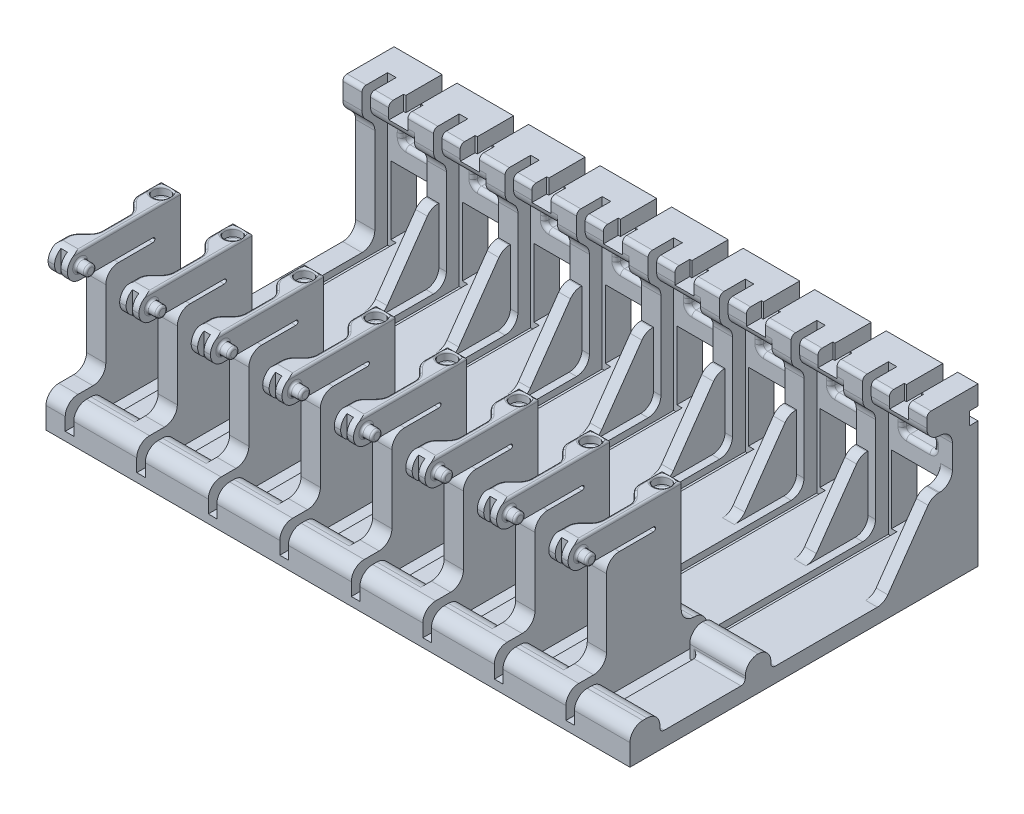
from build123d import *

# Parameters (mm, degrees)
SKETCH1_W            = 19.5
SKETCH1_H            = 81.5
BOSS_EXTRUDE1_DEPTH  = 2.5
SKETCH2_W            = 19.5
SKETCH2_H            = 6
BOSS_EXTRUDE2_DEPTH  = 33.5
SKETCH3_W            = 11.5
SKETCH3_H            = 16
CUT_EXTRUDE1_DEPTH   = 38
SKETCH4_W            = 2
SKETCH4_H            = 75.5
CUT_EXTRUDE2_DEPTH   = 1.5
BOSS_EXTRUDE10_DEPTH = 4.5
BOSS_EXTRUDE12_START = 2
SKETCH17_W           = 6
SKETCH17_H           = 4.5
SKETCH17_W_2         = 7
SKETCH17_H_2         = 6
BOSS_EXTRUDE12_DEPTH = 4
SKETCH22_W           = 4
SKETCH22_H           = 20
CUT_EXTRUDE6_DEPTH   = 1.5
SKETCH15_W           = 15.5
SKETCH15_H           = 6
CUT_EXTRUDE4_DEPTH   = 3
CHAMFER3_SIZE        = 3.5
SKETCH18_R           = 1.25
BOSS_EXTRUDE13_DEPTH = 2.5
FILLET11_R           = 0.5
CUT_EXTRUDE5_REACH   = 93.206
SKETCH20_W           = 1.5
SKETCH20_H           = 3
SKETCH21_W           = 2.75
SKETCH21_H           = 16
BOSS_EXTRUDE15_DEPTH = 2.5
CHAMFER4_SIZE        = 19.279998091
CHAMFER4_SIZE_2      = 13.5
SKETCH24_W           = 6
SKETCH24_H           = 6
SKETCH24_H_2         = 4.5
SKETCH24_W_2         = 7
BOSS_EXTRUDE17_DEPTH = 9
SKETCH29_W           = 7.5
SKETCH29_H           = 3
CUT_EXTRUDE9_DEPTH   = 86.88655308
SKETCH31_W           = 19.5
SKETCH31_H           = 81.5
BOSS_EXTRUDE20_DEPTH = 1
SKETCH32_R           = 1
CUT_EXTRUDE10_DEPTH  = 33.5
SKETCH33_R           = 1.875
CUT_EXTRUDE11_DEPTH  = 2
CUT_EXTRUDE12_DEPTH  = 3.5
FILLET10_R           = 3
FILLET15_R           = 1
FILLET16_R           = 0.5
CUT_EXTRUDE14_DEPTH  = 2
LPATTERN6_COUNT      = 8
LPATTERN6_PITCH      = 16.75


with BuildPart() as part:
    # Sketch1 → Boss-Extrude1 (new body)
    with BuildSketch(Plane(origin=(0, 0, 0), x_dir=(1, 0, 0), z_dir=(0, 1, 0))):
        with Locations((9.75, 40.75)):
            Rectangle(SKETCH1_W, SKETCH1_H)
    extrude(amount=BOSS_EXTRUDE1_DEPTH)

    # Sketch2 → Boss-Extrude2 (add)
    with BuildSketch(Plane(origin=(0, 2.5, 0), x_dir=(1, 0, 0), z_dir=(0, 1, 0))):
        with Locations((9.75, 78.5)):
            Rectangle(SKETCH2_W, SKETCH2_H)
    extrude(amount=BOSS_EXTRUDE2_DEPTH)

    # Sketch3 → Cut-Extrude1 (cut)
    with BuildSketch(Plane.XY.offset(-75.5)):
        with Locations((11, 10.5)):
            Rectangle(SKETCH3_W, SKETCH3_H)
    extrude(amount=-CUT_EXTRUDE1_DEPTH, mode=Mode.SUBTRACT)

    # Sketch4 → Cut-Extrude2 (cut)
    with BuildSketch(Plane(origin=(0, 2.5, 0), x_dir=(1, 0, 0), z_dir=(0, 1, 0))):
        with Locations((5.5, 37.75)):
            Rectangle(SKETCH4_W, SKETCH4_H)
    extrude(amount=-CUT_EXTRUDE2_DEPTH, mode=Mode.SUBTRACT)

    # Sketch14 → Boss-Extrude10 (add)
    with BuildSketch(Plane.ZY):
        Polygon((-75.5, 36), (-69.5, 36), (-69.5, 30), (-72.5, 27), (-72.5, 2.5), (-75.5, 2.5), align=None)
        Polygon((-33, 2.5), (-33, 7), (-27, 7), (-27, 15.5), (-27, 21.5), (-27, 36), (-0.5, 36), (-0.5, 30), (-21, 30), (-21, 29), (-9.5, 29), (-9.5, 7), (0, 7), (0, 2.5), align=None)
    extrude(amount=-BOSS_EXTRUDE10_DEPTH)

    # Sketch17 → Boss-Extrude12 (add)
    with BuildSketch(Plane(origin=(4.5, 0, 0), x_dir=(0, 0, -1), z_dir=(1, 0, 0)).offset(BOSS_EXTRUDE12_START)):
        with Locations((30, 4.75)):
            Rectangle(SKETCH17_W, SKETCH17_H)
        with Locations((3.5, 4.75)):
            Rectangle(SKETCH17_W_2, SKETCH17_H)
        with Locations((72.5, 33)):
            Rectangle(SKETCH17_W, SKETCH17_H_2)
    extrude(amount=BOSS_EXTRUDE12_DEPTH)

    # Sketch22 → Cut-Extrude6 (cut)
    with BuildSketch(Plane(origin=(0, 2.5, 0), x_dir=(1, 0, 0), z_dir=(0, 1, 0))):
        with Locations((6.5, 17)):
            Rectangle(SKETCH22_W, SKETCH22_H)
    extrude(amount=-CUT_EXTRUDE6_DEPTH, mode=Mode.SUBTRACT)

    # Sketch15 → Cut-Extrude4 (cut)
    with BuildSketch(Plane.ZY):
        with Locations((-13.25, 33)):
            Rectangle(SKETCH15_W, SKETCH15_H)
    extrude(amount=-CUT_EXTRUDE4_DEPTH, mode=Mode.SUBTRACT)

    # Chamfer3
    # the kernel refuses this chamfer: 3.5 mm, written as the material it adds along each edge
    with BuildSketch(Plane(origin=(3, 36, -21), x_dir=(0, 0, 1), z_dir=(0, -1, 0))) as chamfer3_piece_1_section:
        Polygon((CHAMFER3_SIZE, 0), (0, CHAMFER3_SIZE), (0, 0), align=None)
    chamfer3_piece_1 = extrude(amount=6, mode=Mode.PRIVATE)
    chamfer3_piece_1 = split(chamfer3_piece_1, bisect_by=Plane(origin=(0, 36, -21), z_dir=(1, 0, 0)), keep=Keep.TOP, mode=Mode.PRIVATE)
    add(chamfer3_piece_1)
    with BuildSketch(Plane(origin=(3, 30, -5.5), x_dir=(-1, 0, 0), z_dir=(0, 1, 0))) as chamfer3_piece_2_section:
        Polygon((CHAMFER3_SIZE, 0), (0, -CHAMFER3_SIZE), (0, 0), align=None)
    chamfer3_piece_2 = extrude(amount=6, mode=Mode.PRIVATE)
    chamfer3_piece_2 = split(chamfer3_piece_2, bisect_by=Plane(origin=(0, 30, -5.5), z_dir=(1, 0, 0)), keep=Keep.TOP, mode=Mode.PRIVATE)
    add(chamfer3_piece_2)

    # Sketch18 → Boss-Extrude13 (add)
    with BuildSketch(Plane(origin=(4.5, 0, 0), x_dir=(0, 0, -1), z_dir=(1, 0, 0))):
        with Locations(Location((3.5, 33, 0), (0, 0, 180))):
            Circle(SKETCH18_R)
    extrude(amount=BOSS_EXTRUDE13_DEPTH)

    # Fillet11
    fillet11_edges = [part.edges().sort_by_distance(p)[0] for p in [
        (4.5, 33, -4.75),
        (7, 33, -4.75),
    ]]
    fillet(fillet11_edges, radius=FILLET11_R)

    # Sketch20 → Cut-Extrude5 (cut, up to next)
    with BuildSketch(Plane(origin=(0, 36, 0), x_dir=(1, 0, 0), z_dir=(0, 1, 0)), mode=Mode.PRIVATE) as cut_extrude5_sk1:
        with Locations((2.25, 0.5)):
            Rectangle(SKETCH20_W, SKETCH20_H)
    cut_extrude5_tool1 = extrude(cut_extrude5_sk1.sketch, amount=-CUT_EXTRUDE5_REACH, mode=Mode.PRIVATE) & part.part
    add(cut_extrude5_tool1.solids().sort_by_distance((2.25, 36, -0.5))[0], mode=Mode.SUBTRACT)

    # Sketch21 → Boss-Extrude15 (add)
    with BuildSketch(Plane.XY.offset(-75.5)):
        with Locations((18.125, 10.5)):
            Rectangle(SKETCH21_W, SKETCH21_H)
    extrude(amount=BOSS_EXTRUDE15_DEPTH)

    # Chamfer4
    # the kernel refuses this chamfer: 19.279998091, 13.5 mm, written as the material it adds along each edge
    with BuildSketch(Plane(origin=(19.5, 2.5, -73), x_dir=(0, 1, 0), z_dir=(-1, 0, 0))) as chamfer4_piece_1_section:
        Polygon((CHAMFER4_SIZE, 0), (0, -CHAMFER4_SIZE_2), (0, 0), align=None)
    chamfer4_piece_1 = extrude(amount=2.75, mode=Mode.PRIVATE)
    chamfer4_piece_1 = split(chamfer4_piece_1, bisect_by=Plane(origin=(19.5, 18.5, -73), z_dir=(0, -1, 0)), keep=Keep.TOP, mode=Mode.PRIVATE)
    add(chamfer4_piece_1)

    # Sketch24 → Boss-Extrude17 (add)
    with BuildSketch(Plane(origin=(10.5, 0, 0), x_dir=(0, 0, -1), z_dir=(1, 0, 0))):
        with Locations((72.5, 33)):
            Rectangle(SKETCH24_W, SKETCH24_H)
        with Locations((30, 4.75)):
            Rectangle(SKETCH24_W, SKETCH24_H_2)
        with Locations((3.5, 4.75)):
            Rectangle(SKETCH24_W_2, SKETCH24_H_2)
    extrude(amount=BOSS_EXTRUDE17_DEPTH)

    # Sketch29 → Cut-Extrude9 (cut, through all)
    with BuildSketch(Plane.XY.offset(-75.5)):
        with Locations((11.5, 24.5)):
            Rectangle(SKETCH29_W, SKETCH29_H)
    extrude(amount=-CUT_EXTRUDE9_DEPTH, mode=Mode.SUBTRACT)

    # Sketch31 → Boss-Extrude20 (add)
    with BuildSketch(Plane.XZ):
        with Locations((9.75, -40.75)):
            Rectangle(SKETCH31_W, SKETCH31_H)
    extrude(amount=BOSS_EXTRUDE20_DEPTH)

    # Sketch32 → Cut-Extrude10 (cut)
    with BuildSketch(Plane(origin=(0, 36, 0), x_dir=(1, 0, 0), z_dir=(0, 1, 0))):
        with Locations(Location((2.25, 24.75, 0), (0, 0, 270))):
            Circle(SKETCH32_R)
    extrude(amount=-CUT_EXTRUDE10_DEPTH, mode=Mode.SUBTRACT)

    # Sketch33 → Cut-Extrude11 (cut)
    with BuildSketch(Plane(origin=(0, 36, 0), x_dir=(1, 0, 0), z_dir=(0, 1, 0))):
        with Locations(Location((2.25, 24.75, 0), (0, 0, 270))):
            Circle(SKETCH33_R)
    extrude(amount=-CUT_EXTRUDE11_DEPTH, mode=Mode.SUBTRACT)

    # Sketch34 → Cut-Extrude12 (cut)
    with BuildSketch(Plane(origin=(0, 36, 0), x_dir=(1, 0, 0), z_dir=(0, 1, 0))):
        Polygon((10.75, 69.5), (10.75, 73), (11.25, 73), (11.25, 81.5), (14.75, 81.5), (14.75, 73), (15.25, 73), (15.25, 69.5), align=None)
    extrude(amount=-CUT_EXTRUDE12_DEPTH, mode=Mode.SUBTRACT)

    # Fillet10
    # the kernel refuses this fillet: 3 mm, written as the material it adds along each edge
    with BuildSketch(Plane(origin=(0, 2.5, -72.5), x_dir=(0, 1, 0), z_dir=(1, 0, 0)), Plane(origin=(0, 7, -27), x_dir=(0, 0, -1), z_dir=(1, 0, 0))) as fillet10_piece_1:
        with BuildLine():
            CenterArc((FILLET10_R, FILLET10_R), FILLET10_R, 180, 90)
            Line((0, FILLET10_R), (0, 0))
            Line((0, 0), (FILLET10_R, 0))
        make_face()
    extrude(amount=4.5)
    with BuildSketch(Plane(origin=(0, 7, -9.5), x_dir=(0, 0, 1), z_dir=(1, 0, 0))) as fillet10_piece_2:
        with BuildLine():
            CenterArc((FILLET10_R, -FILLET10_R), FILLET10_R, 90, 90)
            Line((0, -FILLET10_R), (0, 0))
            Line((0, 0), (FILLET10_R, 0))
        make_face()
    extrude(amount=4.5)
    with BuildSketch(Plane(origin=(3, 36, -17.5), x_dir=(-0.7071067811865475, 0, -0.7071067811865475), z_dir=(0, -1, 0))) as fillet10_piece_3:
        with BuildLine():
            CenterArc((FILLET10_R * 0.414213562373, -FILLET10_R), FILLET10_R, 90, 45)
            Line((-FILLET10_R * 0.292893218813, -FILLET10_R * 0.292893218813), (0, 0))
            Line((0, 0), (FILLET10_R * 0.414213562373, 0))
        make_face()
    extrude(amount=6)
    with BuildSketch(Plane(origin=(3, 30, -9), x_dir=(0, 0, -1), z_dir=(0, 1, 0))) as fillet10_piece_4:
        with BuildLine():
            CenterArc((FILLET10_R * 0.414213562373, FILLET10_R), FILLET10_R, 225, 45)
            Line((-FILLET10_R * 0.292893218813, FILLET10_R * 0.292893218813), (0, 0))
            Line((0, 0), (FILLET10_R * 0.414213562373, 0))
        make_face()
    extrude(amount=6)
    with BuildSketch(Plane(origin=(19.5, 2.5, -59.5), x_dir=(0, 0.8191520442887333, -0.5735764363514153), z_dir=(-1, 0, 0))) as fillet10_piece_5:
        with BuildLine():
            CenterArc((FILLET10_R * 0.520567050551, -FILLET10_R), FILLET10_R, 90, 55)
            Line((-FILLET10_R * 0.298584993737, -FILLET10_R * 0.426423563649), (0, 0))
            Line((0, 0), (FILLET10_R * 0.520567050551, 0))
        make_face()
    extrude(amount=2.75)
    with BuildSketch(Plane(origin=(0, 27, -72.5), x_dir=(0, 0.7071067811865461, 0.707106781186549), z_dir=(1, 0, 0))) as fillet10_piece_6:
        with BuildLine():
            CenterArc((FILLET10_R * 0.414213562373, FILLET10_R), FILLET10_R, 225, 45)
            Line((-FILLET10_R * 0.292893218813, FILLET10_R * 0.292893218813), (0, 0))
            Line((0, 0), (FILLET10_R * 0.414213562373, 0))
        make_face()
    extrude(amount=4.5)
    with BuildSketch(Plane(origin=(16.75, 18.5, -75.5), x_dir=(0, 0, 1), z_dir=(1, 0, 0))) as fillet10_piece_7:
        with BuildLine():
            CenterArc((FILLET10_R, -FILLET10_R), FILLET10_R, 90, 90)
            Line((0, -FILLET10_R), (0, 0))
            Line((0, 0), (FILLET10_R, 0))
        make_face()
    extrude(amount=2.75)
    with BuildSketch(Plane(origin=(19.5, 30, -75.5), x_dir=(0, 0, 1), z_dir=(-1, 0, 0))) as fillet10_piece_8:
        with BuildLine():
            CenterArc((FILLET10_R, -FILLET10_R), FILLET10_R, 90, 90)
            Line((0, -FILLET10_R), (0, 0))
            Line((0, 0), (FILLET10_R, 0))
        make_face()
    extrude(amount=13)
    # the kernel refuses this fillet: 3 mm, written as the material it takes off along each edge
    with BuildSketch(Plane(origin=(0, 39.106601718, -6), x_dir=(0.7071067811865476, 0, -0.7071067811865476), z_dir=(0, -1, 0))) as fillet10_2_piece_1:
        with BuildLine():
            CenterArc((FILLET10_R * 0.414213562373, FILLET10_R), FILLET10_R, 225, 45)
            Line((-FILLET10_R * 0.292893218813, FILLET10_R * 0.292893218813), (0, 0))
            Line((0, 0), (FILLET10_R * 0.414213562373, 0))
        make_face()
    extrude(amount=12.213203436, mode=Mode.SUBTRACT)
    with BuildSketch(Plane(origin=(-4.5, 30, -0.5), x_dir=(0, 1, 0), z_dir=(1, 0, 0)), Plane(origin=(-4.5, 36, -0.5), x_dir=(0, 0, -1), z_dir=(1, 0, 0))) as fillet10_2_piece_2:
        with BuildLine():
            CenterArc((FILLET10_R, -FILLET10_R), FILLET10_R, 90, 90)
            Line((0, -FILLET10_R), (0, 0))
            Line((0, 0), (FILLET10_R, 0))
        make_face()
    extrude(amount=16.5, mode=Mode.SUBTRACT)
    with BuildSketch(Plane(origin=(-7.5, 29, -9.5), x_dir=(0, -1, 0), z_dir=(1, 0, 0)), Plane(origin=(-7.5, 7, -33), x_dir=(0, 0, 1), z_dir=(1, 0, 0)), Plane(origin=(-7.5, 7, 0), x_dir=(0, -1, 0), z_dir=(1, 0, 0))) as fillet10_2_piece_3:
        with BuildLine():
            CenterArc((FILLET10_R, FILLET10_R), FILLET10_R, 180, 90)
            Line((0, FILLET10_R), (0, 0))
            Line((0, 0), (FILLET10_R, 0))
        make_face()
    extrude(amount=19.5, mode=Mode.SUBTRACT)
    with BuildSketch(Plane(origin=(27, 7, -27), x_dir=(0, -1, 0), z_dir=(-1, 0, 0))) as fillet10_2_piece_4_section:
        with BuildLine():
            CenterArc((FILLET10_R, -FILLET10_R), FILLET10_R, 90, 90)
            Line((0, -FILLET10_R), (0, 0))
            Line((0, 0), (FILLET10_R, 0))
        make_face()
    fillet10_2_piece_4 = extrude(amount=28, mode=Mode.PRIVATE)
    fillet10_2_piece_4 = split(fillet10_2_piece_4, bisect_by=Plane(origin=(4.5, 7, -27), z_dir=(1, 0, 0)), keep=Keep.TOP, mode=Mode.PRIVATE)
    add(fillet10_2_piece_4, mode=Mode.SUBTRACT)
    with BuildSketch(Plane(origin=(-1, 7, -7), x_dir=(0, 0, 1), z_dir=(1, 0, 0))) as fillet10_2_piece_5_section:
        with BuildLine():
            CenterArc((FILLET10_R, FILLET10_R), FILLET10_R, 180, 90)
            Line((0, FILLET10_R), (0, 0))
            Line((0, 0), (FILLET10_R, 0))
        make_face()
    fillet10_2_piece_5 = extrude(amount=28, mode=Mode.PRIVATE)
    fillet10_2_piece_5 = split(fillet10_2_piece_5, bisect_by=Plane(origin=(4.5, 7, -7), z_dir=(1, 0, 0)), keep=Keep.TOP, mode=Mode.PRIVATE)
    add(fillet10_2_piece_5, mode=Mode.SUBTRACT)
    with BuildSketch(Plane(origin=(12.845747121, 18.5, -70.703320611), x_dir=(0, -0.8191520442887318, 0.5735764363514175), z_dir=(1, 0, 0))) as fillet10_2_piece_6:
        with BuildLine():
            CenterArc((FILLET10_R * 0.520567050551, FILLET10_R), FILLET10_R, 215, 55)
            Line((-FILLET10_R * 0.298584993737, FILLET10_R * 0.426423563649), (0, 0))
            Line((0, 0), (FILLET10_R * 0.520567050551, 0))
        make_face()
    extrude(amount=10.558505758, mode=Mode.SUBTRACT)
    with BuildSketch(Plane(origin=(6.5, 30, -69.5), x_dir=(0, 1, 0), z_dir=(1, 0, 0))) as fillet10_2_piece_7:
        with BuildLine():
            CenterArc((FILLET10_R, -FILLET10_R), FILLET10_R, 90, 90)
            Line((0, -FILLET10_R), (0, 0))
            Line((0, 0), (FILLET10_R, 0))
        make_face()
    extrude(amount=20.5, mode=Mode.SUBTRACT)
    with BuildSketch(Plane(origin=(-3.106601718, 30, -69.5), x_dir=(0, -0.7071067811865447, -0.7071067811865503), z_dir=(1, 0, 0))) as fillet10_2_piece_8:
        with BuildLine():
            CenterArc((FILLET10_R * 0.414213562373, FILLET10_R), FILLET10_R, 225, 45)
            Line((-FILLET10_R * 0.292893218813, FILLET10_R * 0.292893218813), (0, 0))
            Line((0, 0), (FILLET10_R * 0.414213562373, 0))
        make_face()
    extrude(amount=10.713203436, mode=Mode.SUBTRACT)
    with BuildSketch(Plane(origin=(-1, 7, -33), x_dir=(0, 0, 1), z_dir=(1, 0, 0))) as fillet10_2_piece_9:
        with BuildLine():
            CenterArc((FILLET10_R, FILLET10_R), FILLET10_R, 180, 90)
            Line((0, FILLET10_R), (0, 0))
            Line((0, 0), (FILLET10_R, 0))
        make_face()
    extrude(amount=28, mode=Mode.SUBTRACT)
    with BuildSketch(Plane(origin=(0, 39.106601718, -20.5), x_dir=(0, 0, -1), z_dir=(0, -1, 0))) as fillet10_2_piece_10_section:
        with BuildLine():
            CenterArc((FILLET10_R * 0.414213562373, FILLET10_R), FILLET10_R, 225, 45)
            Line((-FILLET10_R * 0.292893218813, FILLET10_R * 0.292893218813), (0, 0))
            Line((0, 0), (FILLET10_R * 0.414213562373, 0))
        make_face()
    fillet10_2_piece_10 = extrude(amount=12.213203436, mode=Mode.PRIVATE)
    fillet10_2_piece_10 = split(fillet10_2_piece_10, bisect_by=Plane(origin=(0, 29, -20.5), z_dir=(0, 1, 0)), keep=Keep.TOP, mode=Mode.PRIVATE)
    add(fillet10_2_piece_10, mode=Mode.SUBTRACT)
    with BuildSketch(Plane(origin=(27, 7, 0), x_dir=(0, -1, 0), z_dir=(-1, 0, 0))) as fillet10_2_piece_11:
        with BuildLine():
            CenterArc((FILLET10_R, -FILLET10_R), FILLET10_R, 90, 90)
            Line((0, -FILLET10_R), (0, 0))
            Line((0, 0), (FILLET10_R, 0))
        make_face()
    extrude(amount=28, mode=Mode.SUBTRACT)

    # Fillet15
    fillet15_edges = [part.edges().sort_by_distance(p)[0] for p in [
        (14, 2.5, -27),
        (13, 2.5, -33),
        (14, 2.5, -7),
        (17.375, 36, -69.5),
        (8.5, 1.75, -7),
        (8.5, 1.75, -27),
        (15.25, 24.5, -81.5),
        (15.25, 26, -78.5),
        (11.5, 23, -81.5),
        (15.25, 23, -78.5),
        (7.75, 24.5, -81.5),
        (7.75, 23, -78.5),
        (11.5, 26, -81.5),
        (7.75, 26, -78.5),
        (15.25, 24.5, -75.5),
        (11.5, 26, -75.5),
        (7.75, 24.5, -75.5),
        (11.5, 23, -75.5),
        (8.625, 36, -69.5),
        (2.25, 36, -69.5),
        (2.25, 2.5, -33),
    ]]
    fillet(fillet15_edges, radius=FILLET15_R - 0.0001)  # a hair under: the kernel refuses the full size

    # Fillet16
    # the kernel refuses this fillet: 0.5 mm, written as the material it adds along each edge
    with BuildSketch(Plane(origin=(-1.156627738, 29, -21), x_dir=(0, 0, 1), z_dir=(1, 0, 0))) as fillet16_piece_1_section:
        with BuildLine():
            CenterArc((FILLET16_R, -FILLET16_R), FILLET16_R, 90, 90)
            Line((0, -FILLET16_R), (0, 0))
            Line((0, 0), (FILLET16_R, 0))
        make_face()
    fillet16_piece_1 = extrude(amount=5.656627738, mode=Mode.PRIVATE)
    fillet16_piece_1 = fillet16_piece_1 & Plane(origin=(3, 29, -21.742640687), x_dir=(0, 0, -1), z_dir=(0, 1, 0)) * Cylinder(3, 14, mode=Mode.PRIVATE)
    add(fillet16_piece_1)
    with BuildSketch(Plane(origin=(-1.156627738, 30, -21), x_dir=(0, 0, 1), z_dir=(1, 0, 0))) as fillet16_piece_2_section:
        with BuildLine():
            CenterArc((FILLET16_R, FILLET16_R), FILLET16_R, 180, 90)
            Line((0, FILLET16_R), (0, 0))
            Line((0, 0), (FILLET16_R, 0))
        make_face()
    fillet16_piece_2 = extrude(amount=5.656627738, mode=Mode.PRIVATE)
    fillet16_piece_2 = fillet16_piece_2 & Plane(origin=(3, 30, -21.742640687), x_dir=(0, 0, -1), z_dir=(0, 1, 0)) * Cylinder(3, 14, mode=Mode.PRIVATE)
    add(fillet16_piece_2)
    # the kernel refuses this fillet: 0.5 mm, written as the material it takes off along each edge
    with BuildSketch(Plane(origin=(2.25, 34, -24.75), x_dir=(0, 0, 1), z_dir=(-1, 0, 0))) as fillet16_2_piece_1:
        with BuildLine():
            CenterArc((1 + FILLET16_R, -FILLET16_R), FILLET16_R, 90, 90)
            Line((1, -FILLET16_R), (1, 0))
            Line((1, 0), (1 + FILLET16_R, 0))
        make_face()
    revolve(axis=Axis((2.25, 34, -24.75), (0, 1, 0)), mode=Mode.SUBTRACT)
    with BuildSketch(Plane(origin=(2.25, 36, -24.75), x_dir=(0, 0, 1), z_dir=(-1, 0, 0))) as fillet16_2_piece_2:
        with BuildLine():
            CenterArc((1.875 + FILLET16_R, -FILLET16_R), FILLET16_R, 90, 90)
            Line((1.875, -FILLET16_R), (1.875, 0))
            Line((1.875, 0), (1.875 + FILLET16_R, 0))
        make_face()
    revolve(axis=Axis((2.25, 36, -24.75), (0, 1, 0)), mode=Mode.SUBTRACT)
    with BuildSketch(Plane(origin=(0, 36, -4.757359313), x_dir=(1, 0, 0), z_dir=(0, 0, 1))) as fillet16_2_piece_3:
        with BuildLine():
            CenterArc((FILLET16_R, -FILLET16_R), FILLET16_R, 90, 90)
            Line((0, -FILLET16_R), (0, 0))
            Line((0, 0), (FILLET16_R, 0))
        make_face()
    extrude(amount=3.382359313, mode=Mode.SUBTRACT)
    with BuildSketch(Plane(origin=(3, 36, -4.757359313), x_dir=(-0.7071067811865478, 0, -0.7071067811865472), z_dir=(0.7071067811865472, 0, -0.7071067811865478))) as fillet16_2_piece_4:
        with BuildLine():
            CenterArc((3 - FILLET16_R, -FILLET16_R), FILLET16_R, 0, 90)
            Line((3, -FILLET16_R), (3, 0))
            Line((3, 0), (3 - FILLET16_R, 0))
        make_face()
    revolve(axis=Axis((3, 36, -4.757359313), (0, 1, 0)), revolution_arc=45, mode=Mode.SUBTRACT)
    with BuildSketch(Plane(origin=(0.878679656, 36, -6.878679656), x_dir=(0.7071067811865476, 0, 0.7071067811865476), z_dir=(0.7071067811865476, 0, -0.7071067811865476)), Plane(origin=(2.121320344, 36, -18.378679656), x_dir=(0.7071067811865475, 0, -0.7071067811865475), z_dir=(-0.7071067811865476, 0, -0.7071067811865476))) as fillet16_2_piece_5:
        with BuildLine():
            CenterArc((FILLET16_R, FILLET16_R), FILLET16_R, 180, 90)
            Line((0, FILLET16_R), (0, 0))
            Line((0, 0), (FILLET16_R, 0))
        make_face()
    extrude(amount=1.757359313, mode=Mode.SUBTRACT)
    with BuildSketch(Plane(origin=(0, 36, -10.242640687), x_dir=(0.7071067811865476, 0, 0.7071067811865475), z_dir=(-0.7071067811865475, 0, 0.7071067811865476))) as fillet16_2_piece_6:
        with BuildLine():
            CenterArc((3 + FILLET16_R, -FILLET16_R), FILLET16_R, 90, 90)
            Line((3, -FILLET16_R), (3, 0))
            Line((3, 0), (3 + FILLET16_R, 0))
        make_face()
    revolve(axis=Axis((0, 36, -10.242640687), (0, 1, 0)), revolution_arc=45, mode=Mode.SUBTRACT)
    with BuildSketch(Plane(origin=(3, 36, -10.242640687), x_dir=(1, 0, 0), z_dir=(0, 0, -1))) as fillet16_2_piece_7:
        with BuildLine():
            CenterArc((FILLET16_R, FILLET16_R), FILLET16_R, 180, 90)
            Line((0, FILLET16_R), (0, 0))
            Line((0, 0), (FILLET16_R, 0))
        make_face()
    extrude(amount=6.014718626, mode=Mode.SUBTRACT)
    with BuildSketch(Plane(origin=(0, 36, -16.257359313), x_dir=(0.7071067811865477, 0, -0.7071067811865475), z_dir=(-0.7071067811865475, 0, -0.7071067811865477))) as fillet16_2_piece_8:
        with BuildLine():
            CenterArc((3 + FILLET16_R, FILLET16_R), FILLET16_R, 180, 90)
            Line((3, FILLET16_R), (3, 0))
            Line((3, 0), (3 + FILLET16_R, 0))
        make_face()
    revolve(axis=Axis((0, 36, -16.257359313), (0, -1, 0)), revolution_arc=45, mode=Mode.SUBTRACT)
    with BuildSketch(Plane(origin=(3, 36, -21.742640687), x_dir=(-1, 0, 0), z_dir=(0, 0, -1))) as fillet16_2_piece_9:
        with BuildLine():
            CenterArc((3 - FILLET16_R, -FILLET16_R), FILLET16_R, 0, 90)
            Line((3, -FILLET16_R), (3, 0))
            Line((3, 0), (3 - FILLET16_R, 0))
        make_face()
    revolve(axis=Axis((3, 36, -21.742640687), (0, 1, 0)), revolution_arc=45, mode=Mode.SUBTRACT)
    with BuildSketch(Plane(origin=(4.5, 36, -28.25), x_dir=(-1, 0, 0), z_dir=(0, 0, 1))) as fillet16_2_piece_10:
        with BuildLine():
            CenterArc((FILLET16_R, FILLET16_R), FILLET16_R, 180, 90)
            Line((0, FILLET16_R), (0, 0))
            Line((0, 0), (FILLET16_R, 0))
        make_face()
    extrude(amount=26.875, mode=Mode.SUBTRACT)
    with BuildSketch(Plane(origin=(0, 36, -28.25), x_dir=(0, -1, 0), z_dir=(0, 0, 1))) as fillet16_2_piece_11:
        with BuildLine():
            CenterArc((FILLET16_R, FILLET16_R), FILLET16_R, 180, 90)
            Line((0, FILLET16_R), (0, 0))
            Line((0, 0), (FILLET16_R, 0))
        make_face()
    extrude(amount=6.507359313, mode=Mode.SUBTRACT)
    with BuildSketch(Plane(origin=(-1.25, 36, -27), x_dir=(0, 0, 1), z_dir=(1, 0, 0))) as fillet16_2_piece_12:
        with BuildLine():
            CenterArc((FILLET16_R, FILLET16_R), FILLET16_R, 180, 90)
            Line((0, FILLET16_R), (0, 0))
            Line((0, 0), (FILLET16_R, 0))
        make_face()
    extrude(amount=7, mode=Mode.SUBTRACT)

    # Sketch36 → Cut-Extrude14 (cut)
    with BuildSketch(Plane(origin=(0, 0, -81.5), x_dir=(-1, 0, 0), z_dir=(0, 0, -1))):
        Polygon((-19.5, 31.5), (-14.75, 31.5), (-14.75, 32.5), (-11.25, 32.5), (-11.25, 31.5), (0, 31.5), (0, 28.5), (-19.5, 28.5), align=None)
    extrude(amount=-CUT_EXTRUDE14_DEPTH, mode=Mode.SUBTRACT)


with BuildPart() as lpattern6_1:
    # LPattern6: pattern copy
    add(part.part.moved(Location(Vector(1, 0, 0) * (1 * LPATTERN6_PITCH))))


with BuildPart() as lpattern6_2:
    # LPattern6: pattern copy
    add(part.part.moved(Location(Vector(1, 0, 0) * (2 * LPATTERN6_PITCH))))


with BuildPart() as lpattern6_3:
    # LPattern6: pattern copy
    add(part.part.moved(Location(Vector(1, 0, 0) * (3 * LPATTERN6_PITCH))))


with BuildPart() as lpattern6_4:
    # LPattern6: pattern copy
    add(part.part.moved(Location(Vector(1, 0, 0) * (4 * LPATTERN6_PITCH))))


with BuildPart() as lpattern6_5:
    # LPattern6: pattern copy
    add(part.part.moved(Location(Vector(1, 0, 0) * (5 * LPATTERN6_PITCH))))


with BuildPart() as lpattern6_6:
    # LPattern6: pattern copy
    add(part.part.moved(Location(Vector(1, 0, 0) * (6 * LPATTERN6_PITCH))))


with BuildPart() as lpattern6_7:
    # LPattern6: pattern copy
    add(part.part.moved(Location(Vector(1, 0, 0) * (7 * LPATTERN6_PITCH))))

    # Combine2: read off the stored shape, not the designer's step
    # Combine2: union LPattern6_1, part, LPattern6_3, LPattern6_5, LPattern6_2, LPattern6_4, LPattern6_6
    add(lpattern6_1.part)
    add(part.part)
    add(lpattern6_3.part)
    add(lpattern6_5.part)
    add(lpattern6_2.part)
    add(lpattern6_4.part)
    add(lpattern6_6.part)


solid = lpattern6_7.part
